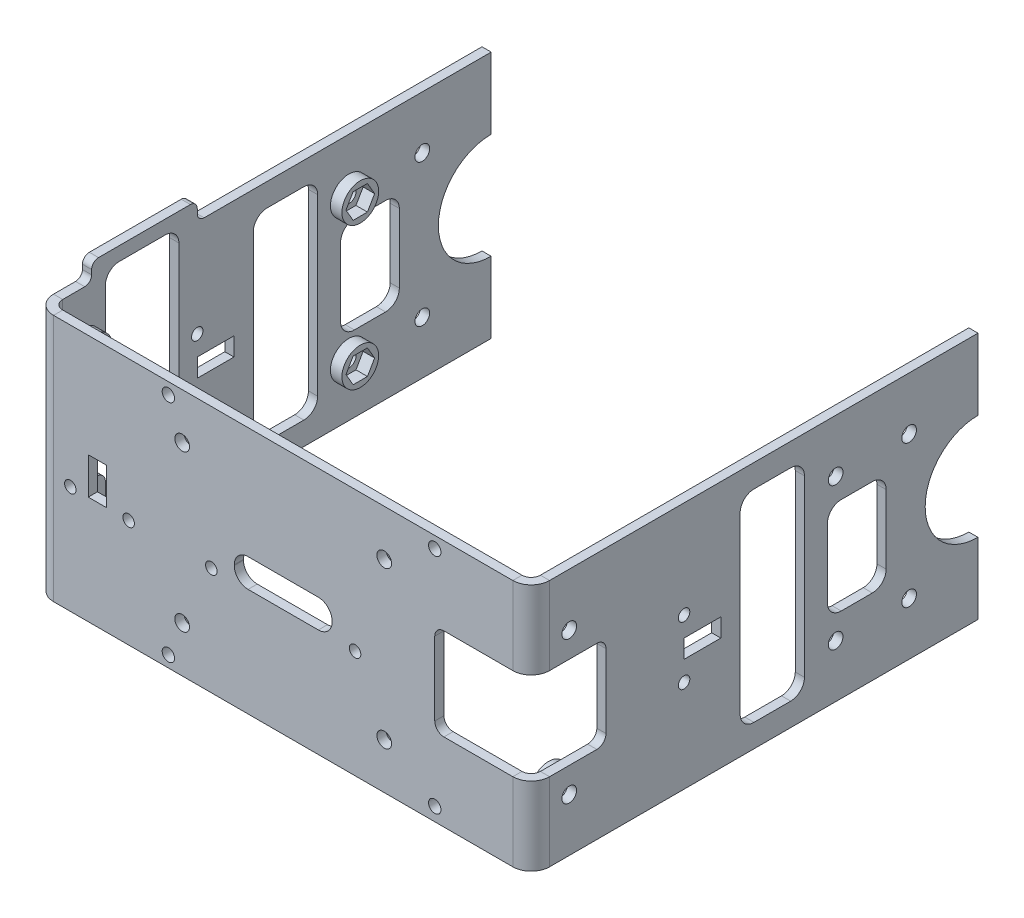
from build123d import *

# Parameters (mm, degrees)
SZKIC1_R                        = 1.6
SZKIC1_R_2                      = 1.25
SZKIC1_W                        = 4
SZKIC1_H                        = 8
DODANIE_WYCI_GNI_CIE2_DEPTH     = 2
SZKIC_START                     = -157.387814563
SZKIC_ZGI_CIA9_OUTLINE_W        = 62
SZKIC_ZGI_CIA9_OUTLINE_H        = 2
SZKIC_ZGI_CIA9_DEPTH            = 94.37752
SZKIC_START_2                   = -61.410294563
SZKIC_ZGI_CIA9_2_OUTLINE_R      = 1.6
SZKIC_ZGI_CIA9_2_DEPTH          = 0.02248
SZKIC_START_3                   = -63.387814563
SZKIC_ZGI_CIA9_3_OUTLINE_R      = 1.6
SZKIC_ZGI_CIA9_3_DEPTH          = 3.57752
SZKIC_START_4                   = -32.35389443
SZKIC_ZGI_CIA9_4_DEPTH          = 62
SZKIC_START_5                   = -28.35389443
SZKIC_ZGI_CIA9_5_DEPTH          = 54
SZKIC_START_6                   = 44.189705437
SZKIC_ZGI_CIA10_OUTLINE_W       = 54
SZKIC_ZGI_CIA10_OUTLINE_H       = 2
SZKIC_ZGI_CIA10_DEPTH           = 94.42248
SZKIC_START_7                   = 40.612185437
SZKIC_ZGI_CIA10_2_OUTLINE_R     = 1.6
SZKIC_ZGI_CIA10_2_DEPTH         = 4
SZKIC_START_8                   = -29
SZKIC_ZGI_CIA10_3_DEPTH         = 56
SZKIC35_R                       = 1.6
SZKIC35_R_2                     = 1.35
WYTNIJ_WYCI_GNI_CIE1_DEPTH      = 3
WYTNIJ_WYCI_GNI_CIE2_DEPTH      = 148.616067211
WYTNIJ_WYCI_GNI_CIE2_DEPTH_BACK = 148.616067211
SZKIC36_R                       = 1.25
SZKIC36_W                       = 8
SZKIC36_H                       = 4
WYTNIJ_WYCI_GNI_CIE3_DEPTH      = 148.616067211
WYTNIJ_WYCI_GNI_CIE3_DEPTH_BACK = 10
SZKIC39_R                       = 4
DODANIE_WYCI_GNI_CIE3_DEPTH     = 2.5
DODANIE_WYCI_GNI_CIE4_START     = 101.5
SZKIC39_3_R                     = 4
DODANIE_WYCI_GNI_CIE4_DEPTH     = 2.5
SZKIC40_R                       = 4
DODANIE_WYCI_GNI_CIE5_DEPTH     = 2.5


with BuildPart() as part:
    # Szkic1 → Dodanie-wyciągnięcie2 (new body)
    with BuildSketch(Plane.XY):
        with BuildLine():
            Line((-157.387814563, 25.64610557), (-157.387814563, 10.14610557))
            ThreePointArc((-157.387814563, 10.14610557), (-145.887814563, -1.35389443), (-157.387814563, -12.85389443))
            Line((-157.387814563, -12.85389443), (-157.387814563, -28.35389443))
            Line((-157.387814563, -28.35389443), (-94.887814563, -28.35389443))
            ThreePointArc((-94.887814563, -28.35389443), (-93.827154392, -28.793234258), (-93.387814563, -29.85389443))
            Line((-93.387814563, -29.85389443), (-93.387814563, -30.85389443))
            ThreePointArc((-93.387814563, -30.85389443), (-92.948474735, -31.914554602), (-91.887814563, -32.35389443))
            Line((-91.887814563, -32.35389443), (-71.887814563, -32.35389443))
            ThreePointArc((-71.887814563, -32.35389443), (-70.827154392, -31.914554602), (-70.387814563, -30.85389443))
            Line((-70.387814563, -30.85389443), (-70.387814563, -29.85389443))
            ThreePointArc((-70.387814563, -29.85389443), (-69.948474735, -28.793234258), (-68.887814563, -28.35389443))
            Line((-68.887814563, -28.35389443), (-54.387814563, -28.35389443))
            Line((-54.387814563, -28.35389443), (10.612185437, -28.35389443))
            Line((10.612185437, -28.35389443), (49.612185437, -28.35389443))
            Line((49.612185437, -28.35389443), (76.612185437, -28.35389443))
            Line((76.612185437, -28.35389443), (138.612185437, -28.35389443))
            Line((138.612185437, -28.35389443), (138.612185437, -12.85389443))
            ThreePointArc((138.612185437, -12.85389443), (127.112185437, -1.35389443), (138.612185437, 10.14610557))
            Line((138.612185437, 10.14610557), (138.612185437, 25.64610557))
            Line((138.612185437, 25.64610557), (76.612185437, 25.64610557))
            Line((76.612185437, 25.64610557), (49.612185437, 25.64610557))
            Line((49.612185437, 25.64610557), (-68.887814563, 25.64610557))
            ThreePointArc((-68.887814563, 25.64610557), (-69.948474735, 26.085445398), (-70.387814563, 27.14610557))
            Line((-70.387814563, 27.14610557), (-70.387814563, 28.14610557))
            ThreePointArc((-70.387814563, 28.14610557), (-70.827154392, 29.206765742), (-71.887814563, 29.64610557))
            Line((-71.887814563, 29.64610557), (-91.887814563, 29.64610557))
            ThreePointArc((-91.887814563, 29.64610557), (-92.948474735, 29.206765742), (-93.387814563, 28.14610557))
            Line((-93.387814563, 28.14610557), (-93.387814563, 27.14610557))
            ThreePointArc((-93.387814563, 27.14610557), (-93.827154392, 26.085445398), (-94.887814563, 25.64610557))
            Line((-94.887814563, 25.64610557), (-157.387814563, 25.64610557))
        make_face()
        with Locations((-126.387814563, -16.85389443)):
            Circle(SZKIC1_R, mode=Mode.SUBTRACT)
        with Locations((-126.387814563, 14.14610557)):
            Circle(SZKIC1_R, mode=Mode.SUBTRACT)
        with Locations((107.612185437, -16.85389443)):
            Circle(SZKIC1_R, mode=Mode.SUBTRACT)
        with Locations((107.612185437, 14.14610557)):
            Circle(SZKIC1_R, mode=Mode.SUBTRACT)
        with Locations((123.612185437, -16.85389443)):
            Circle(SZKIC1_R, mode=Mode.SUBTRACT)
        with Locations((123.612185437, 14.14610557)):
            Circle(SZKIC1_R, mode=Mode.SUBTRACT)
        with Locations((-142.387814563, -16.85389443)):
            Circle(SZKIC1_R, mode=Mode.SUBTRACT)
        with Locations((-142.387814563, 14.14610557)):
            Circle(SZKIC1_R, mode=Mode.SUBTRACT)
        with Locations((-43.037814563, -4.85389443)):
            Circle(SZKIC1_R_2, mode=Mode.SUBTRACT)
        with Locations((-25.037814563, -4.85389443)):
            Circle(SZKIC1_R_2, mode=Mode.SUBTRACT)
        with Locations((6.262185437, -4.85389443)):
            Circle(SZKIC1_R_2, mode=Mode.SUBTRACT)
        with Locations((-68.387814563, -16.85389443)):
            Circle(SZKIC1_R, mode=Mode.SUBTRACT)
        with Locations((-68.387814563, 14.14610557)):
            Circle(SZKIC1_R, mode=Mode.SUBTRACT)
        with Locations((49.612185437, -16.85389443)):
            Circle(SZKIC1_R, mode=Mode.SUBTRACT)
        with Locations((49.612185437, 14.14610557)):
            Circle(SZKIC1_R, mode=Mode.SUBTRACT)
        with Locations((-55.737814563, -4.85389443)):
            Circle(SZKIC1_R_2, mode=Mode.SUBTRACT)
        with BuildLine():
            Line((25.612185437, 8.64610557), (55.612185437, 8.64610557))
            ThreePointArc((55.612185437, 8.64610557), (57.026398999, 8.060319132), (57.612185437, 6.64610557))
            Line((57.612185437, 6.64610557), (57.612185437, -9.35389443))
            ThreePointArc((57.612185437, -9.35389443), (57.026398999, -10.768107992), (55.612185437, -11.35389443))
            Line((55.612185437, -11.35389443), (25.612185437, -11.35389443))
            ThreePointArc((25.612185437, -11.35389443), (24.197971874, -10.768107992), (23.612185437, -9.35389443))
            Line((23.612185437, -9.35389443), (23.612185437, 6.64610557))
            ThreePointArc((23.612185437, 6.64610557), (24.197971874, 8.060319132), (25.612185437, 8.64610557))
        make_face(mode=Mode.SUBTRACT)
        with Locations((-49.830596702, -0.85389443)):
            Rectangle(SZKIC1_W, SZKIC1_H, mode=Mode.SUBTRACT)
    extrude(amount=DODANIE_WYCI_GNI_CIE2_DEPTH)

    # Szkic zgięcia9: read off the stored shape, not the designer's step
    # Szkic zgięcia9 outline → Szkic zgięcia9 (cut)
    with BuildSketch(Plane.YZ.offset(SZKIC_START)):
        with Locations((-1.35389443, 1)):
            Rectangle(SZKIC_ZGI_CIA9_OUTLINE_W, SZKIC_ZGI_CIA9_OUTLINE_H)
    extrude(amount=SZKIC_ZGI_CIA9_DEPTH, mode=Mode.SUBTRACT)

    # Szkic zgi_cia9 2 outline → Szkic zgi_cia9 2 (add)
    with BuildSketch(Plane.YZ.offset(SZKIC_START_2)):
        with BuildLine():
            Line((-28.35389443, 0), (-28.35389443, -6.78761102))
            ThreePointArc((-28.35389443, -6.78761102), (-28.793234259, -7.848271192), (-29.85389443, -8.28761102))
            Line((-29.85389443, -8.28761102), (-30.85389443, -8.28761102))
            ThreePointArc((-30.85389443, -8.28761102), (-31.914554602, -8.726950848), (-32.35389443, -9.78761102))
            Line((-32.35389443, -9.78761102), (-32.35389443, -29.78761102))
            ThreePointArc((-32.35389443, -29.78761102), (-31.914554601, -30.848271191), (-30.85389443, -31.28761102))
            Line((-30.85389443, -31.28761102), (-29.85389443, -31.28761102))
            ThreePointArc((-29.85389443, -31.28761102), (-28.793234258, -31.726950848), (-28.35389443, -32.78761102))
            Line((-28.35389443, -32.78761102), (-28.35389443, -95.28761102))
            Line((-28.35389443, -95.28761102), (-12.85389443, -95.28761102))
            ThreePointArc((-12.85389443, -95.28761102), (-1.35389443, -83.78761102), (10.14610557, -95.28761102))
            Line((10.14610557, -95.28761102), (25.64610557, -95.28761102))
            Line((25.64610557, -95.28761102), (25.64610557, -32.78761102))
            ThreePointArc((25.64610557, -32.78761102), (26.085445398, -31.726950848), (27.14610557, -31.28761102))
            Line((27.14610557, -31.28761102), (28.14610557, -31.28761102))
            ThreePointArc((28.14610557, -31.28761102), (29.206765741, -30.848271192), (29.64610557, -29.78761102))
            Line((29.64610557, -29.78761102), (29.64610557, -9.78761102))
            ThreePointArc((29.64610557, -9.78761102), (29.206765742, -8.726950848), (28.14610557, -8.28761102))
            Line((28.14610557, -8.28761102), (27.14610557, -8.28761102))
            ThreePointArc((27.14610557, -8.28761102), (26.085445398, -7.848271191), (25.64610557, -6.78761102))
            Line((25.64610557, -6.78761102), (25.64610557, 0))
            Line((25.64610557, 0), (-28.35389443, 0))
        make_face()
        with Locations((-16.85389443, -80.28761102)):
            Circle(SZKIC_ZGI_CIA9_2_OUTLINE_R, mode=Mode.SUBTRACT)
        with Locations((-16.85389443, -64.28761102)):
            Circle(SZKIC_ZGI_CIA9_2_OUTLINE_R, mode=Mode.SUBTRACT)
        with Locations((14.14610557, -80.28761102)):
            Circle(SZKIC_ZGI_CIA9_2_OUTLINE_R, mode=Mode.SUBTRACT)
        with Locations((14.14610557, -64.28761102)):
            Circle(SZKIC_ZGI_CIA9_2_OUTLINE_R, mode=Mode.SUBTRACT)
        with Locations((-16.85389443, -6.28761102)):
            Circle(SZKIC_ZGI_CIA9_2_OUTLINE_R, mode=Mode.SUBTRACT)
        with Locations((14.14610557, -6.28761102)):
            Circle(SZKIC_ZGI_CIA9_2_OUTLINE_R, mode=Mode.SUBTRACT)
    extrude(amount=SZKIC_ZGI_CIA9_2_DEPTH)

    # Szkic zgi_cia9 3 outline → Szkic zgi_cia9 3 (add)
    with BuildSketch(Plane.YZ.offset(SZKIC_START_3)):
        with BuildLine():
            Line((-28.35389443, 0), (-28.35389443, -6.78761102))
            ThreePointArc((-28.35389443, -6.78761102), (-28.793234259, -7.848271192), (-29.85389443, -8.28761102))
            Line((-29.85389443, -8.28761102), (-30.85389443, -8.28761102))
            ThreePointArc((-30.85389443, -8.28761102), (-31.914554602, -8.726950848), (-32.35389443, -9.78761102))
            Line((-32.35389443, -9.78761102), (-32.35389443, -29.78761102))
            ThreePointArc((-32.35389443, -29.78761102), (-31.914554601, -30.848271191), (-30.85389443, -31.28761102))
            Line((-30.85389443, -31.28761102), (-29.85389443, -31.28761102))
            ThreePointArc((-29.85389443, -31.28761102), (-28.793234258, -31.726950848), (-28.35389443, -32.78761102))
            Line((-28.35389443, -32.78761102), (-28.35389443, -95.28761102))
            Line((-28.35389443, -95.28761102), (-12.85389443, -95.28761102))
            ThreePointArc((-12.85389443, -95.28761102), (-1.35389443, -83.78761102), (10.14610557, -95.28761102))
            Line((10.14610557, -95.28761102), (25.64610557, -95.28761102))
            Line((25.64610557, -95.28761102), (25.64610557, -32.78761102))
            ThreePointArc((25.64610557, -32.78761102), (26.085445398, -31.726950848), (27.14610557, -31.28761102))
            Line((27.14610557, -31.28761102), (28.14610557, -31.28761102))
            ThreePointArc((28.14610557, -31.28761102), (29.206765741, -30.848271192), (29.64610557, -29.78761102))
            Line((29.64610557, -29.78761102), (29.64610557, -9.78761102))
            ThreePointArc((29.64610557, -9.78761102), (29.206765742, -8.726950848), (28.14610557, -8.28761102))
            Line((28.14610557, -8.28761102), (27.14610557, -8.28761102))
            ThreePointArc((27.14610557, -8.28761102), (26.085445398, -7.848271191), (25.64610557, -6.78761102))
            Line((25.64610557, -6.78761102), (25.64610557, 0))
            Line((25.64610557, 0), (-28.35389443, 0))
        make_face()
        with Locations((-16.85389443, -80.28761102)):
            Circle(SZKIC_ZGI_CIA9_3_OUTLINE_R, mode=Mode.SUBTRACT)
        with Locations((-16.85389443, -64.28761102)):
            Circle(SZKIC_ZGI_CIA9_3_OUTLINE_R, mode=Mode.SUBTRACT)
        with Locations((14.14610557, -80.28761102)):
            Circle(SZKIC_ZGI_CIA9_3_OUTLINE_R, mode=Mode.SUBTRACT)
        with Locations((14.14610557, -64.28761102)):
            Circle(SZKIC_ZGI_CIA9_3_OUTLINE_R, mode=Mode.SUBTRACT)
        with Locations((-16.85389443, -6.28761102)):
            Circle(SZKIC_ZGI_CIA9_3_OUTLINE_R, mode=Mode.SUBTRACT)
        with Locations((14.14610557, -6.28761102)):
            Circle(SZKIC_ZGI_CIA9_3_OUTLINE_R, mode=Mode.SUBTRACT)
    extrude(amount=SZKIC_ZGI_CIA9_3_DEPTH)

    # Szkic zgi_cia9 4 outline → Szkic zgi_cia9 4 (cut)
    with BuildSketch(Plane(origin=(0, 0, 0), x_dir=(1, 0, 0), z_dir=(0, 1, 0)).offset(SZKIC_START_4)):
        with BuildLine():
            ThreePointArc((-59.387814563, -2), (-62.216241688, -0.828427125), (-63.387814563, 2))
            Line((-63.387814563, 2), (-63.387814563, 0))
            Line((-63.387814563, 0), (-63.010294563, 0))
            Line((-63.010294563, 0), (-63.010294563, -2))
            Line((-63.010294563, -2), (-59.387814563, -2))
        make_face()
        with BuildLine():
            ThreePointArc((-61.387814563, 2), (-60.94424638, 0.744006369), (-59.810294563, 0.045131552))
            Line((-59.810294563, 0.045131552), (-59.810294563, 95.28761102))
            Line((-59.810294563, 95.28761102), (-61.387814563, 95.28761102))
            Line((-61.387814563, 95.28761102), (-61.387814563, 2))
        make_face()
    extrude(amount=SZKIC_ZGI_CIA9_4_DEPTH, mode=Mode.SUBTRACT)

    # Szkic zgi_cia9 5 outline → Szkic zgi_cia9 5 (add)
    with BuildSketch(Plane(origin=(0, 0, 0), x_dir=(1, 0, 0), z_dir=(0, 1, 0)).offset(SZKIC_START_5)):
        with BuildLine():
            ThreePointArc((-59.387814563, 0), (-59.600256442, 0.011314895), (-59.810294563, 0.045131552))
            Line((-59.810294563, 0.045131552), (-59.810294563, 0))
            Line((-59.810294563, 0), (-59.387814563, 0))
        make_face()
    extrude(amount=SZKIC_ZGI_CIA9_5_DEPTH)

    # Szkic zgięcia10: read off the stored shape, not the designer's step
    # Szkic zgięcia10 outline → Szkic zgięcia10 (cut)
    with BuildSketch(Plane.YZ.offset(SZKIC_START_6)):
        with Locations((-1.35389443, 1)):
            Rectangle(SZKIC_ZGI_CIA10_OUTLINE_W, SZKIC_ZGI_CIA10_OUTLINE_H)
    extrude(amount=SZKIC_ZGI_CIA10_DEPTH, mode=Mode.SUBTRACT)

    # Szkic zgi_cia10 2 outline → Szkic zgi_cia10 2 (add)
    with BuildSketch(Plane.YZ.offset(SZKIC_START_7)):
        with BuildLine():
            Line((-11.35389443, 0), (-28.35389443, 0))
            Line((-28.35389443, 0), (-28.35389443, -95.28761102))
            Line((-28.35389443, -95.28761102), (-12.85389443, -95.28761102))
            ThreePointArc((-12.85389443, -95.28761102), (-1.35389443, -83.78761102), (10.14610557, -95.28761102))
            Line((10.14610557, -95.28761102), (25.64610557, -95.28761102))
            Line((25.64610557, -95.28761102), (25.64610557, 0))
            Line((25.64610557, 0), (8.64610557, 0))
            Line((8.64610557, 0), (8.64610557, -12.28761102))
            ThreePointArc((8.64610557, -12.28761102), (8.060319132, -13.701824582), (6.64610557, -14.28761102))
            Line((6.64610557, -14.28761102), (-9.35389443, -14.28761102))
            ThreePointArc((-9.35389443, -14.28761102), (-10.768107992, -13.701824582), (-11.35389443, -12.28761102))
            Line((-11.35389443, -12.28761102), (-11.35389443, 0))
        make_face()
        with Locations((-16.85389443, -80.28761102)):
            Circle(SZKIC_ZGI_CIA10_2_OUTLINE_R, mode=Mode.SUBTRACT)
        with Locations((-16.85389443, -64.28761102)):
            Circle(SZKIC_ZGI_CIA10_2_OUTLINE_R, mode=Mode.SUBTRACT)
        with Locations((14.14610557, -80.28761102)):
            Circle(SZKIC_ZGI_CIA10_2_OUTLINE_R, mode=Mode.SUBTRACT)
        with Locations((14.14610557, -64.28761102)):
            Circle(SZKIC_ZGI_CIA10_2_OUTLINE_R, mode=Mode.SUBTRACT)
        with Locations((-16.85389443, -6.28761102)):
            Circle(SZKIC_ZGI_CIA10_2_OUTLINE_R, mode=Mode.SUBTRACT)
        with Locations((14.14610557, -6.28761102)):
            Circle(SZKIC_ZGI_CIA10_2_OUTLINE_R, mode=Mode.SUBTRACT)
    extrude(amount=SZKIC_ZGI_CIA10_2_DEPTH)

    # Szkic zgi_cia10 3 outline → Szkic zgi_cia10 3 (cut)
    with BuildSketch(Plane(origin=(0, 0, 0), x_dir=(1, 0, 0), z_dir=(0, 1, 0)).offset(SZKIC_START_8)):
        with BuildLine():
            ThreePointArc((44.612185437, 2), (43.440612562, -0.828427125), (40.612185437, -2))
            Line((40.612185437, -2), (44.189705437, -2))
            Line((44.189705437, -2), (44.189705437, 0))
            Line((44.189705437, 0), (44.612185437, 0))
            Line((44.612185437, 0), (44.612185437, 2))
        make_face()
        with BuildLine():
            Line((40.612185437, 95.28761102), (40.612185437, 0))
            ThreePointArc((40.612185437, 0), (42.026398999, 0.585786438), (42.612185437, 2))
            Line((42.612185437, 2), (42.612185437, 95.28761102))
            Line((42.612185437, 95.28761102), (40.612185437, 95.28761102))
        make_face()
    extrude(amount=SZKIC_ZGI_CIA10_3_DEPTH, mode=Mode.SUBTRACT)

    # Szkic35 → Wytnij-wyciągnięcie1 (cut)
    with BuildSketch(Plane.XY.offset(2)):
        with Locations((12.612185437, 15.64610557)):
            Circle(SZKIC35_R)
        with Locations((-34.387814563, -25.85389443)):
            Circle(SZKIC35_R_2)
        with Locations((-34.387814563, 23.14610557)):
            Circle(SZKIC35_R_2)
        with Locations((23.612185437, -25.42420086)):
            Circle(SZKIC35_R_2)
        with Locations((23.612185437, 23.14610557)):
            Circle(SZKIC35_R_2)
        with Locations((-31.387814563, 15.64610557)):
            Circle(SZKIC35_R)
        with Locations((-31.387814563, -18.35389443)):
            Circle(SZKIC35_R)
        with Locations((12.612185437, -18.35389443)):
            Circle(SZKIC35_R)
        with BuildLine():
            Line((-1.737814563, -4.85389443), (-17.037814563, -4.85389443))
            ThreePointArc((-17.037814563, -4.85389443), (-19.159134907, -3.975214774), (-20.037814563, -1.85389443))
            Line((-20.037814563, -1.85389443), (-20.037814563, -1.681203075))
            ThreePointArc((-20.037814563, -1.681203075), (-19.159134907, 0.440117269), (-17.037814563, 1.318796925))
            Line((-17.037814563, 1.318796925), (-1.737814563, 1.318796925))
            ThreePointArc((-1.737814563, 1.318796925), (0.38350578, 0.440117269), (1.262185437, -1.681203075))
            Line((1.262185437, -1.681203075), (1.262185437, -1.85389443))
            ThreePointArc((1.262185437, -1.85389443), (0.38350578, -3.975214774), (-1.737814563, -4.85389443))
        make_face()
    extrude(amount=-WYTNIJ_WYCI_GNI_CIE1_DEPTH, mode=Mode.SUBTRACT)

    # Szkic36 → Wytnij-wyciągnięcie2 (cut, two sides: drawn at the far end of the back side and taken through both)
    with BuildSketch(Plane.ZY.offset(63.387814563).offset(-WYTNIJ_WYCI_GNI_CIE2_DEPTH_BACK)):
        with Locations((-31.28761102, 4.491204428)):
            Circle(SZKIC36_R)
        with Locations((-31.28761102, -8.208795572)):
            Circle(SZKIC36_R)
        with BuildLine():
            Line((-54.5, 20.64610557), (-46.5, 20.64610557))
            ThreePointArc((-46.5, 20.64610557), (-44.378679656, 19.767425913), (-43.5, 17.64610557))
            Line((-43.5, 17.64610557), (-43.5, -20.35389443))
            ThreePointArc((-43.5, -20.35389443), (-44.378679656, -22.475214774), (-46.5, -23.35389443))
            Line((-46.5, -23.35389443), (-54.5, -23.35389443))
            ThreePointArc((-54.5, -23.35389443), (-56.621320344, -22.475214774), (-57.5, -20.35389443))
            Line((-57.5, -20.35389443), (-57.5, 17.64610557))
            ThreePointArc((-57.5, 17.64610557), (-56.621320344, 19.767425913), (-54.5, 20.64610557))
        make_face()
        with BuildLine():
            Line((-72.28761102, 9.14610557), (-65.5, 9.14610557))
            ThreePointArc((-65.5, 9.14610557), (-63.378679656, 8.267425913), (-62.5, 6.14610557))
            Line((-62.5, 6.14610557), (-62.5, -8.85389443))
            ThreePointArc((-62.5, -8.85389443), (-63.378679656, -10.975214774), (-65.5, -11.85389443))
            Line((-65.5, -11.85389443), (-72.28761102, -11.85389443))
            ThreePointArc((-72.28761102, -11.85389443), (-74.408931363, -10.975214774), (-75.28761102, -8.85389443))
            Line((-75.28761102, -8.85389443), (-75.28761102, 6.14610557))
            ThreePointArc((-75.28761102, 6.14610557), (-74.408931363, 8.267425913), (-72.28761102, 9.14610557))
        make_face()
        with Locations((-35.28761102, -1.858795572)):
            Rectangle(SZKIC36_W, SZKIC36_H)
    extrude(amount=WYTNIJ_WYCI_GNI_CIE2_DEPTH + WYTNIJ_WYCI_GNI_CIE2_DEPTH_BACK, mode=Mode.SUBTRACT)

    # Szkic38 → Wytnij-wyciągnięcie3 (cut, two sides: drawn at the far end of the back side and taken through both)
    with BuildSketch(Plane.ZY.offset(63.387814563).offset(-WYTNIJ_WYCI_GNI_CIE3_DEPTH_BACK)):
        with BuildLine():
            Line((-24.28761102, 26.64610557), (-14.28761102, 26.64610557))
            ThreePointArc((-14.28761102, 26.64610557), (-12.166290676, 25.767425913), (-11.28761102, 23.64610557))
            Line((-11.28761102, 23.64610557), (-11.28761102, 10.64610557))
            ThreePointArc((-11.28761102, 10.64610557), (-10.701824582, 9.231892008), (-9.28761102, 8.64610557))
            Line((-9.28761102, 8.64610557), (-8.28761102, 8.64610557))
            ThreePointArc((-8.28761102, 8.64610557), (-6.873397457, 8.060319132), (-6.28761102, 6.64610557))
            Line((-6.28761102, 6.64610557), (-6.28761102, -9.35389443))
            ThreePointArc((-6.28761102, -9.35389443), (-6.873397457, -10.768107992), (-8.28761102, -11.35389443))
            Line((-8.28761102, -11.35389443), (-9.28761102, -11.35389443))
            ThreePointArc((-9.28761102, -11.35389443), (-10.701824582, -11.939680868), (-11.28761102, -13.35389443))
            Line((-11.28761102, -13.35389443), (-11.28761102, -26.35389443))
            ThreePointArc((-11.28761102, -26.35389443), (-12.166290676, -28.475214774), (-14.28761102, -29.35389443))
            Line((-14.28761102, -29.35389443), (-24.28761102, -29.35389443))
            ThreePointArc((-24.28761102, -29.35389443), (-26.408931363, -28.475214774), (-27.28761102, -26.35389443))
            Line((-27.28761102, -26.35389443), (-27.28761102, 23.64610557))
            ThreePointArc((-27.28761102, 23.64610557), (-26.408931363, 25.767425913), (-24.28761102, 26.64610557))
        make_face()
    extrude(amount=WYTNIJ_WYCI_GNI_CIE3_DEPTH + WYTNIJ_WYCI_GNI_CIE3_DEPTH_BACK, mode=Mode.SUBTRACT)

    # Szkic39 → Dodanie-wyciągnięcie3 (add)
    # profile 1 of 4: a face of its own
    with BuildSketch(Plane(origin=(-61.387814563, 0, 0), x_dir=(0, 0, -1), z_dir=(1, 0, 0))):
        with Locations((6.28761102, -16.85389443)):
            Circle(SZKIC39_R)
        Polygon((9.405302473, -16.85389443), (7.846456746, -14.15389443), (4.728765293, -14.15389443), (3.169919566, -16.85389443), (4.728765293, -19.55389443), (7.846456746, -19.55389443), align=None, mode=Mode.SUBTRACT)
    # profile 2 of 4: a face of its own
    with BuildSketch(Plane(origin=(-61.387814563, 0, 0), x_dir=(0, 0, -1), z_dir=(1, 0, 0))):
        with Locations((6.28761102, 14.14610557)):
            Circle(SZKIC39_R)
        Polygon((9.405302473, 14.14610557), (7.846456746, 16.84610557), (4.728765293, 16.84610557), (3.169919566, 14.14610557), (4.728765293, 11.44610557), (7.846456746, 11.44610557), align=None, mode=Mode.SUBTRACT)
    # profile 3 of 4: a face of its own
    with BuildSketch(Plane(origin=(-61.387814563, 0, 0), x_dir=(0, 0, -1), z_dir=(1, 0, 0))):
        with Locations((64.28761102, -16.85389443)):
            Circle(SZKIC39_R)
        Polygon((67.405302473, -16.85389443), (65.846456746, -14.15389443), (62.728765293, -14.15389443), (61.169919566, -16.85389443), (62.728765293, -19.55389443), (65.846456746, -19.55389443), align=None, mode=Mode.SUBTRACT)
    # profile 4 of 4: a face of its own
    with BuildSketch(Plane(origin=(-61.387814563, 0, 0), x_dir=(0, 0, -1), z_dir=(1, 0, 0))):
        with Locations((64.28761102, 14.14610557)):
            Circle(SZKIC39_R)
        Polygon((67.405302473, 14.14610557), (65.846456746, 16.84610557), (62.728765293, 16.84610557), (61.169919566, 14.14610557), (62.728765293, 11.44610557), (65.846456746, 11.44610557), align=None, mode=Mode.SUBTRACT)
    extrude(amount=DODANIE_WYCI_GNI_CIE3_DEPTH)

    # Szkic39<3> → Dodanie-wyciągnięcie4 (add)
    # profile 1 of 4: a face of its own
    with BuildSketch(Plane(origin=(-61.387814563, 0, 0), x_dir=(0, 0, -1), z_dir=(1, 0, 0)).offset(DODANIE_WYCI_GNI_CIE4_START)):
        with Locations((6.28761102, -16.85389443)):
            Circle(SZKIC39_3_R)
        Polygon((9.405302473, -16.85389443), (7.846456746, -14.15389443), (4.728765293, -14.15389443), (3.169919566, -16.85389443), (4.728765293, -19.55389443), (7.846456746, -19.55389443), align=None, mode=Mode.SUBTRACT)
    # profile 2 of 4: a face of its own
    with BuildSketch(Plane(origin=(-61.387814563, 0, 0), x_dir=(0, 0, -1), z_dir=(1, 0, 0)).offset(DODANIE_WYCI_GNI_CIE4_START)):
        with Locations((6.28761102, 14.14610557)):
            Circle(SZKIC39_3_R)
        Polygon((9.405302473, 14.14610557), (7.846456746, 16.84610557), (4.728765293, 16.84610557), (3.169919566, 14.14610557), (4.728765293, 11.44610557), (7.846456746, 11.44610557), align=None, mode=Mode.SUBTRACT)
    # profile 3 of 4: a face of its own
    with BuildSketch(Plane(origin=(-61.387814563, 0, 0), x_dir=(0, 0, -1), z_dir=(1, 0, 0)).offset(DODANIE_WYCI_GNI_CIE4_START)):
        with Locations((64.28761102, -16.85389443)):
            Circle(SZKIC39_3_R)
        Polygon((67.405302473, -16.85389443), (65.846456746, -14.15389443), (62.728765293, -14.15389443), (61.169919566, -16.85389443), (62.728765293, -19.55389443), (65.846456746, -19.55389443), align=None, mode=Mode.SUBTRACT)
    # profile 4 of 4: a face of its own
    with BuildSketch(Plane(origin=(-61.387814563, 0, 0), x_dir=(0, 0, -1), z_dir=(1, 0, 0)).offset(DODANIE_WYCI_GNI_CIE4_START)):
        with Locations((64.28761102, 14.14610557)):
            Circle(SZKIC39_3_R)
        Polygon((67.405302473, 14.14610557), (65.846456746, 16.84610557), (62.728765293, 16.84610557), (61.169919566, 14.14610557), (62.728765293, 11.44610557), (65.846456746, 11.44610557), align=None, mode=Mode.SUBTRACT)
    extrude(amount=DODANIE_WYCI_GNI_CIE4_DEPTH)

    # Szkic40 → Dodanie-wyciągnięcie5 (add)
    # profile 1 of 4: a face of its own
    with BuildSketch(Plane(origin=(0, 0, 0), x_dir=(-1, 0, 0), z_dir=(0, 0, -1))):
        with Locations((-12.612185437, 15.64610557)):
            Circle(SZKIC40_R)
        Polygon((-9.494493983, 15.64610557), (-11.05333971, 18.34610557), (-14.171031163, 18.34610557), (-15.72987689, 15.64610557), (-14.171031163, 12.94610557), (-11.05333971, 12.94610557), align=None, mode=Mode.SUBTRACT)
    # profile 2 of 4: a face of its own
    with BuildSketch(Plane(origin=(0, 0, 0), x_dir=(-1, 0, 0), z_dir=(0, 0, -1))):
        with Locations((31.387814563, 15.64610557)):
            Circle(SZKIC40_R)
        Polygon((34.505506017, 15.64610557), (32.94666029, 18.34610557), (29.828968837, 18.34610557), (28.27012311, 15.64610557), (29.828968837, 12.94610557), (32.94666029, 12.94610557), align=None, mode=Mode.SUBTRACT)
    # profile 3 of 4: a face of its own
    with BuildSketch(Plane(origin=(0, 0, 0), x_dir=(-1, 0, 0), z_dir=(0, 0, -1))):
        with Locations((-12.612185437, -18.35389443)):
            Circle(SZKIC40_R)
        Polygon((-9.494493983, -18.35389443), (-11.05333971, -15.65389443), (-14.171031163, -15.65389443), (-15.72987689, -18.35389443), (-14.171031163, -21.05389443), (-11.05333971, -21.05389443), align=None, mode=Mode.SUBTRACT)
    # profile 4 of 4: a face of its own
    with BuildSketch(Plane(origin=(0, 0, 0), x_dir=(-1, 0, 0), z_dir=(0, 0, -1))):
        with Locations((31.387814563, -18.35389443)):
            Circle(SZKIC40_R)
        Polygon((34.505506017, -18.35389443), (32.94666029, -15.65389443), (29.828968837, -15.65389443), (28.27012311, -18.35389443), (29.828968837, -21.05389443), (32.94666029, -21.05389443), align=None, mode=Mode.SUBTRACT)
    extrude(amount=DODANIE_WYCI_GNI_CIE5_DEPTH)


solid = part.part
